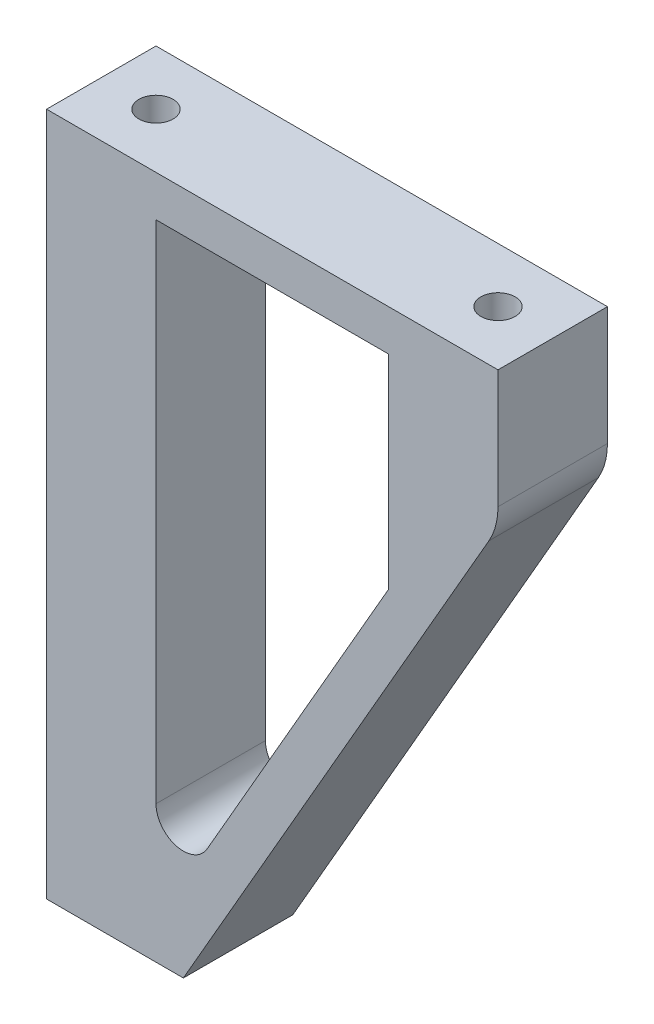
from build123d import *

# Parameters (mm, degrees)
EXTRUDE_976_DEPTH      = 8
SKETCH_6_R             = 1.25
CUT_EXTRUDE_1546_DEPTH = 11
CUT_EXTRUDE_START      = -11
SKETCH_5_R             = 1.25
CUT_EXTRUDE_1765_DEPTH = 11
FILLET_2_R             = 5


with BuildPart() as part:
    # Эскиз1 → Extrude 976 (new body)
    with BuildSketch(Plane.XY):
        Polygon((-16.5, 25), (-16.5, -25), (-6.5, -25), (16.5, 15), (16.5, 25), align=None)
        with BuildLine():
            Line((-8.5, 22), (-8.5, -14.9693287))
            ThreePointArc((-8.5, -14.9693287), (-7.015933517, -16.901636286), (-4.766187394, -15.966270948))
            Line((-4.766187394, -15.966270948), (8.5, 7.105359302))
            Line((8.5, 7.105359302), (8.5, 22))
            Line((8.5, 22), (-8.5, 22))
        make_face(mode=Mode.SUBTRACT)
    extrude(amount=EXTRUDE_976_DEPTH)

    # Эскиз6 → Cut-Extrude 1546 (cut)
    with BuildSketch(Plane(origin=(0, 25, 0), x_dir=(1, 0, 0), z_dir=(0, 1, 0))):
        with Locations((12.5, -4)):
            Circle(SKETCH_6_R)
        with Locations((-12.5, -4)):
            Circle(SKETCH_6_R)
    extrude(amount=-CUT_EXTRUDE_1546_DEPTH, mode=Mode.SUBTRACT)

    # Эскиз5 → Cut-Extrude 1765 (cut)
    with BuildSketch(Plane.XZ.offset(25).offset(CUT_EXTRUDE_START)):
        with Locations((-12.5, 4)):
            Circle(SKETCH_5_R)
    extrude(amount=CUT_EXTRUDE_1765_DEPTH, mode=Mode.SUBTRACT)

    # Скругление2
    fillet_2_edges = [part.edges().sort_by_distance(p)[0] for p in [
        (16.5, 15, 4),
    ]]
    fillet(fillet_2_edges, radius=FILLET_2_R)


solid = part.part
